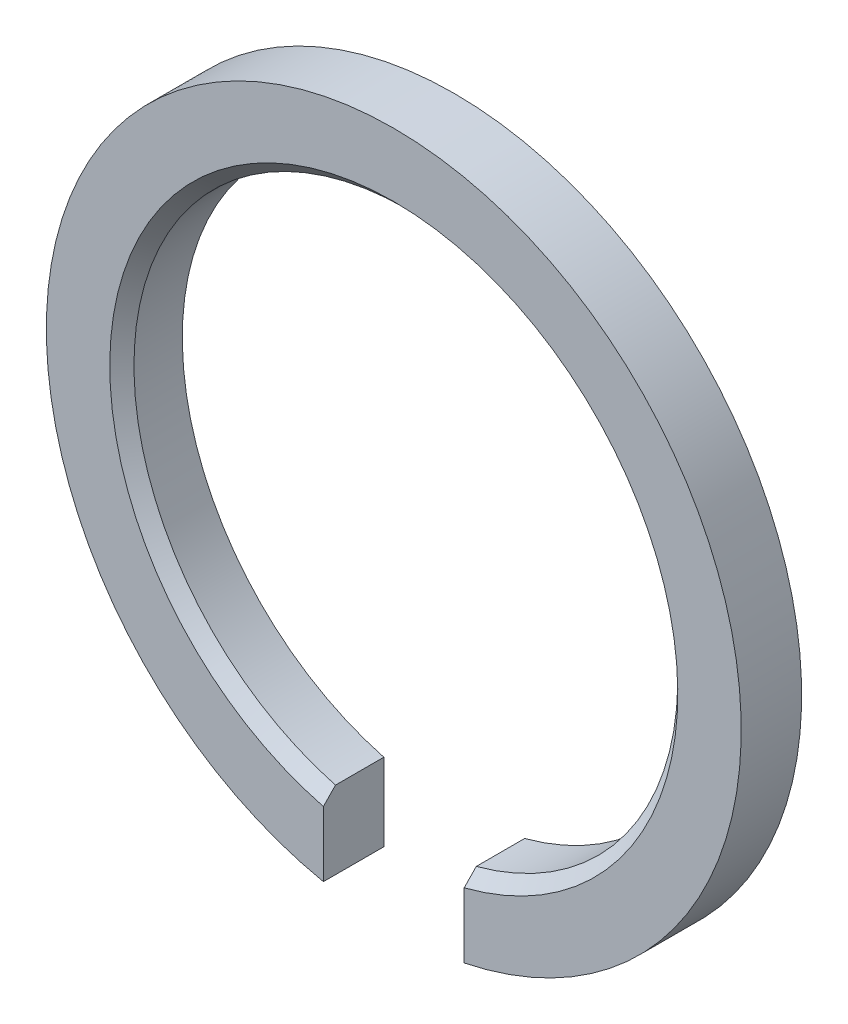
from build123d import *

# Parameters (mm, degrees)
SKETCH1_R           = 57.5
SKETCH1_R_2         = 45
BOSS_EXTRUDE1_DEPTH = 10
CUT_EXTRUDE2_DEPTH  = 10
CHAMFER1_SIZE       = 2


with BuildPart() as part:
    # Sketch1 → Boss-Extrude1 (new body)
    with BuildSketch(Plane(origin=(0, 0, 0), x_dir=(0, 1, 0), z_dir=(0, 0, 1))):
        Circle(SKETCH1_R)
        Circle(SKETCH1_R_2, mode=Mode.SUBTRACT)
    extrude(amount=BOSS_EXTRUDE1_DEPTH)

    # Sketch2 → Cut-Extrude2 (cut)
    with BuildSketch(Plane(origin=(0, 0, 0), x_dir=(1, 0, 0), z_dir=(0, 0, -1))):
        with BuildLine():
            Line((11.650511373, 56.659857386), (11.650511373, 43.46568284))
            add(Edge.make_bspline(
                [(11.650511373, 43.46568284), (-0.679246558, 46.406413024), (-11.650511373, 43.46568284)],
                knots=[0, 0, 0, 0.575547458, 0.575547458, 0.575547458], degree=2))
            Line((-11.650511373, 43.46568284), (-11.650511373, 56.659857386))
            ThreePointArc((-11.650511373, 56.659857386), (0, 57.845257837), (11.650511373, 56.659857386))
        make_face()
    extrude(amount=-CUT_EXTRUDE2_DEPTH, mode=Mode.SUBTRACT)

    # Chamfer1
    chamfer1_edges = [part.edges().sort_by_distance(p)[0] for p in [
        (0, 45, 10),
    ]]
    chamfer(chamfer1_edges, length=CHAMFER1_SIZE)


solid = part.part
